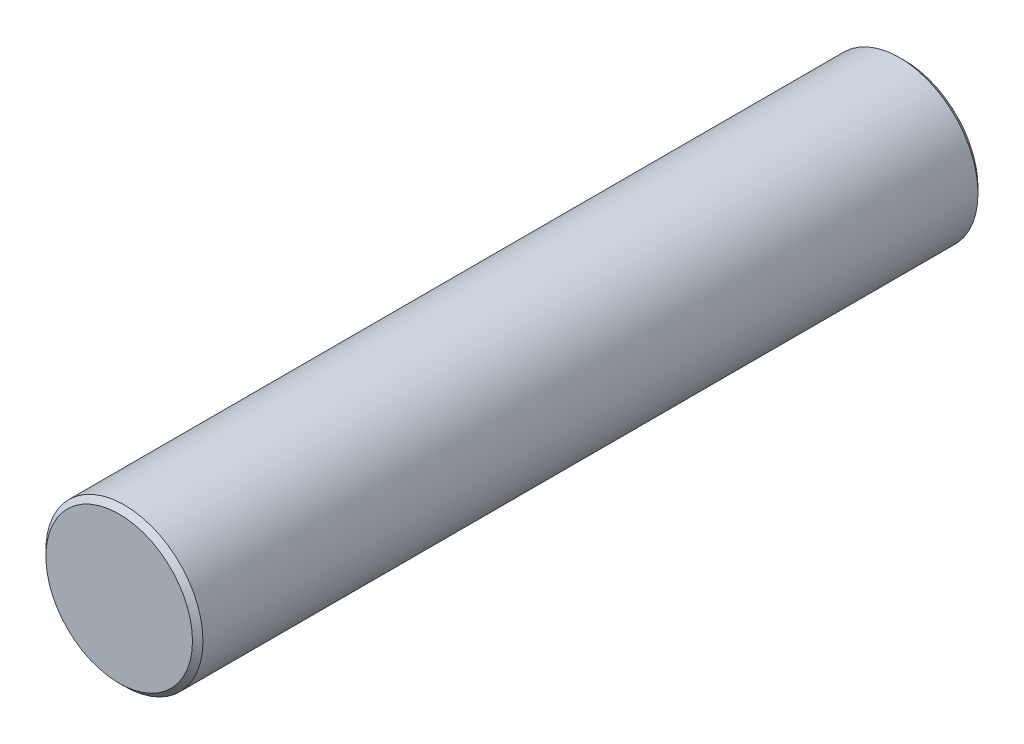
from build123d import *

# Parameters (mm, degrees)
SKETCH1_R           = 30
BOSS_EXTRUDE1_DEPTH = 300
CHAMFER1_SIZE       = 2
SKETCH2_R           = 5
CUT_EXTRUDE1_DEPTH  = 30
THREAD1_PITCH       = 1.5


with BuildPart() as part:
    # Sketch1 → Boss-Extrude1 (new body)
    with BuildSketch(Plane.XY):
        Circle(SKETCH1_R)
    extrude(amount=BOSS_EXTRUDE1_DEPTH)

    # Chamfer1
    chamfer1_edges = [part.edges().sort_by_distance(p)[0] for p in [
        (-30, 0, 0),
        (-30, 0, 300),
    ]]
    chamfer(chamfer1_edges, length=CHAMFER1_SIZE)

    # Sketch2 → Cut-Extrude1 (cut)
    with BuildSketch(Plane(origin=(0, 0, 0), x_dir=(-1, 0, 0), z_dir=(0, 0, -1))):
        Circle(SKETCH2_R)
    extrude(amount=-CUT_EXTRUDE1_DEPTH, mode=Mode.SUBTRACT)

    # Thread1: the profile of Thread Profile1 profile screwed along a right-hand helix of 20 turns, 8 arcs to a turn; built about Z, then put on its axis
    thread1_z = Axis((0, 0, 0), (0, 0, 1))
    thread1_corners = [(5.0003, 0, 1.12517321), (4.18810118, 0, 0.656250002), (4.18810118, 0, 0.468750002), (5.0003, 0, -0.000173205)]
    with BuildLine(mode=Mode.PRIVATE) as thread1_profile:
        Line(thread1_corners[0], thread1_corners[1])
        Line(thread1_corners[1], thread1_corners[2])
        Line(thread1_corners[2], thread1_corners[3])
        Line(thread1_corners[3], thread1_corners[0])
    thread1_cap = Face(thread1_profile.wire())
    thread1_turn_angles = [0, 22.5, 45, 67.5, 90, 112.5, 135, 157.5, 180, 202.5, 225, 247.5, 270, 292.5, 315, 337.5, 360]
    thread1_turn_weights = [1, 0.9238795325112867, 1, 0.9238795325112867, 1, 0.9238795325112867, 1, 0.9238795325112867, 1, 0.9238795325112867, 1, 0.9238795325112867, 1, 0.9238795325112867, 1, 0.9238795325112867, 1]
    thread1_turn_rails = [Edge.make_bspline([Vector(p[0], p[1], 0).rotate(thread1_z, thread1_turn_angles[k]) / thread1_turn_weights[k] + Vector(0, 0, p[2] + THREAD1_PITCH * thread1_turn_angles[k] / 360) for k in range(17)], [0, 0, 0, 1, 1, 2, 2, 3, 3, 4, 4, 5, 5, 6, 6, 7, 7, 8, 8, 8], 2, thread1_turn_weights) for p in thread1_corners]
    thread1_turn_sides = [Face.make_surface_from_curves(thread1_turn_rails[p[0]], thread1_turn_rails[p[1]]) for p in [(0, 1), (1, 2), (2, 3), (3, 0)]]
    thread1 = Plane(origin=(0, 0, 0), x_dir=(1, 0, 0), z_dir=(0, 0, 1)) * Solid(Shell([*[p.moved(Location((0, 0, THREAD1_PITCH * i))) for i in range(20) for p in thread1_turn_sides], thread1_cap, thread1_cap.rotate(thread1_z, 7200).moved(Location((0, 0, THREAD1_PITCH * 7200 / 360)))]))
    add(thread1)


solid = part.part
